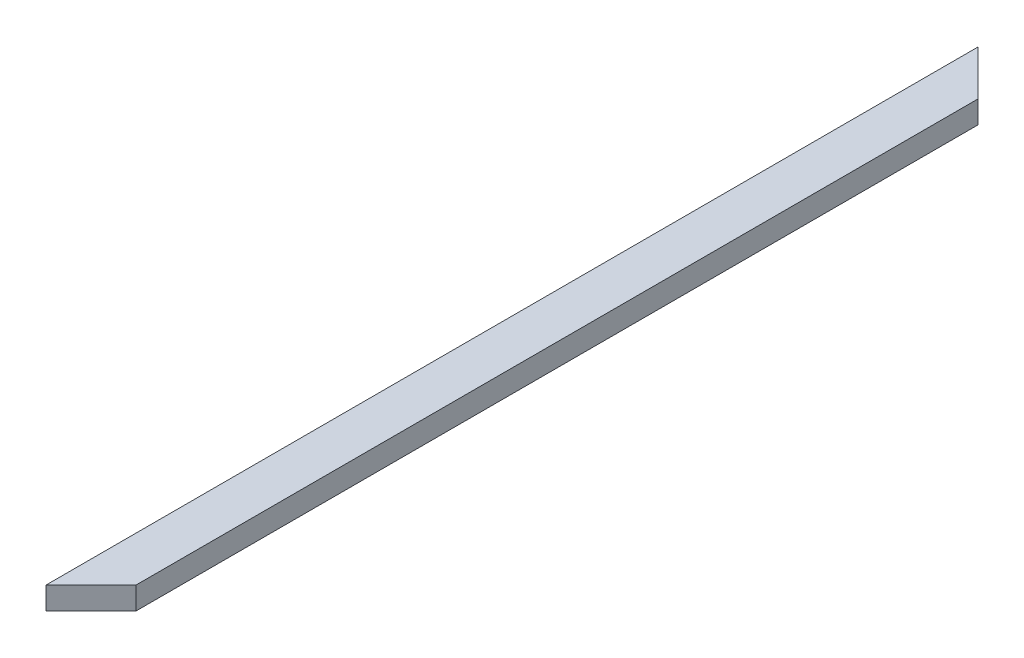
from build123d import *

# Parameters (mm, degrees)
SKETCH1_W           = 14
SKETCH1_H           = 7
BOSS_EXTRUDE1_DEPTH = 290
CUT_EXTRUDE1_DEPTH  = 291.422106597


with BuildPart() as part:
    # Sketch1 → Boss-Extrude1 (new body)
    with BuildSketch(Plane.XY):
        with Locations((7, 3.5)):
            Rectangle(SKETCH1_W, SKETCH1_H)
    extrude(amount=BOSS_EXTRUDE1_DEPTH)

    # Sketch2 → Cut-Extrude1 (cut, through all)
    with BuildSketch(Plane(origin=(0, 7, 0), x_dir=(1, 0, 0), z_dir=(0, 1, 0))):
        Polygon((0, 0), (14, -14), (14, 0), align=None)
        Polygon((14, -290), (0, -290), (14, -276), align=None)
    extrude(amount=-CUT_EXTRUDE1_DEPTH, mode=Mode.SUBTRACT)


solid = part.part
